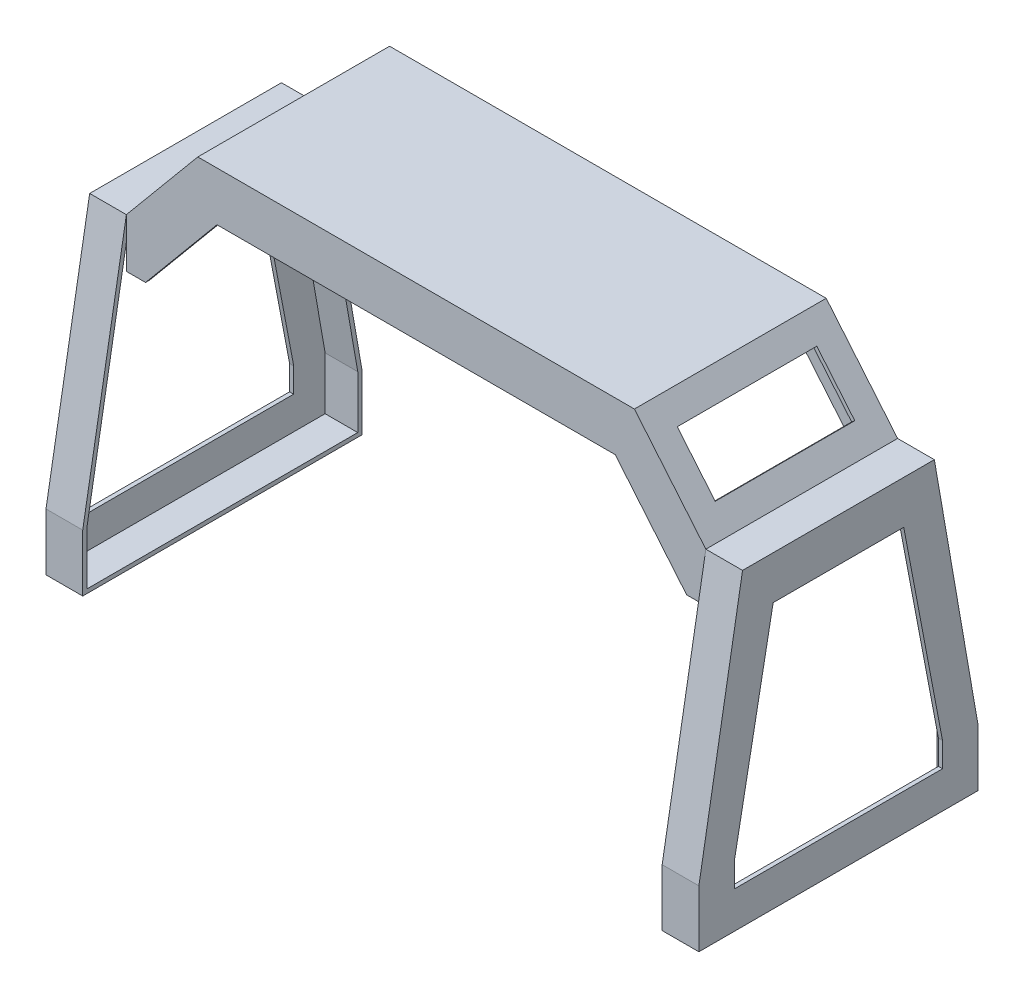
from build123d import *

# Parameters (mm, degrees)
CROQUIS1_W              = 800
CROQUIS1_H              = 342
SALIENTE_EXTRUIR1_DEPTH = 483
CROQUIS2_W              = 710
CROQUIS2_H              = 53.5
CORTAR_EXTRUIR1_DEPTH   = 483
CORTAR_EXTRUIR2_DEPTH   = 342
CORTAR_EXTRUIR4_DEPTH   = 800
VACIADO2_START          = -265.15812527
VACIADO2_OUTLINE_W      = 105
VACIADO2_OUTLINE_H      = 225
VACIADO2_DEPTH          = 530.31625054
VACIADO2_START_2        = -395
VACIADO2_2_DEPTH        = 790
VACIADO2_3_DEPTH        = 40
VACIADO2_START_3        = 355
VACIADO2_4_DEPTH        = 40
VACIADO2_START_4        = -112.5
VACIADO2_5_DEPTH        = 225
CROQUIS8_W              = 171
CROQUIS8_H              = 72.679369328
CORTAR_EXTRUIR7_DEPTH   = 113
CROQUIS9_W              = 171
CROQUIS9_H              = 72.679369328
CORTAR_EXTRUIR8_DEPTH   = 113


with BuildPart() as part:
    # Croquis1 → Saliente-Extruir1 (new body)
    with BuildSketch(Plane(origin=(0, 0, 0), x_dir=(1, 0, 0), z_dir=(0, 1, 0))):
        Rectangle(CROQUIS1_W, CROQUIS1_H)
    extrude(amount=SALIENTE_EXTRUIR1_DEPTH)

    # Croquis2 → Cortar-Extruir1 (cut)
    with BuildSketch(Plane(origin=(0, 483, 0), x_dir=(1, 0, 0), z_dir=(0, 1, 0))):
        with Locations((0, 144.25)):
            Rectangle(CROQUIS2_W, CROQUIS2_H)
        with Locations((0, -144.25)):
            Rectangle(CROQUIS2_W, CROQUIS2_H)
    extrude(amount=-CORTAR_EXTRUIR1_DEPTH, mode=Mode.SUBTRACT)

    # Croquis3 → Cortar-Extruir2 (cut)
    with BuildSketch(Plane.XY.offset(171)):
        Polygon((-355, 317.779645743), (-355, 0), (355, 0), (355, 317.779645743), (331.5, 317.779645743), (244, 422.779645743), (-244, 422.779645743), (-331.5, 317.779645743), align=None)
        Polygon((267.5, 483), (355, 378), (400, 378), (400, 483), align=None)
        Polygon((-400, 483), (-400, 378), (-355, 378), (-267.5, 483), align=None)
    extrude(amount=-CORTAR_EXTRUIR2_DEPTH, mode=Mode.SUBTRACT)

    # Croquis4 → Cortar-Extruir4 (cut)
    with BuildSketch(Plane(origin=(400, 0, 0), x_dir=(0, 0, -1), z_dir=(1, 0, 0))):
        Polygon((171, 378), (171, 70), (117.5, 378), align=None)
        Polygon((-171, 70), (-117.5, 378), (-171, 378), align=None)
        Polygon((-127.5, 45), (127.5, 45), (127.5, 75), (80, 325), (-80, 325), (-127.5, 75), align=None)
    extrude(amount=-CORTAR_EXTRUIR4_DEPTH, mode=Mode.SUBTRACT)

    # Vaciado2: read off the stored shape, not the designer's step
    # Vaciado2 outline → Vaciado2 (cut)
    with BuildSketch(Plane.YZ.offset(VACIADO2_START)):
        with Locations((425.5, 0)):
            Rectangle(VACIADO2_OUTLINE_W, VACIADO2_OUTLINE_H)
    extrude(amount=VACIADO2_DEPTH, mode=Mode.SUBTRACT)

    # Vaciado2 2 outline → Vaciado2 2 (cut)
    with BuildSketch(Plane.YZ.offset(VACIADO2_START_2)):
        Polygon((373, -112.5), (373, 112.5), (317.779645743, 112.5), (317.779645743, 81.371867309), (325, 80), (325, -80), (317.779645743, -81.371867309), (317.779645743, -112.5), align=None)
    extrude(amount=VACIADO2_2_DEPTH, mode=Mode.SUBTRACT)

    # Vaciado2 3 outline → Vaciado2 3 (cut)
    with BuildSketch(Plane.YZ.offset(VACIADO2_START_2)):
        Polygon((69.568973838, 166), (5, 166), (5, -166), (69.568973838, -166), (373, -113.293636689), (373, -112.5), (317.779645743, -112.5), (317.779645743, -81.371867309), (75, -127.5), (45, -127.5), (45, 127.5), (75, 127.5), (317.779645743, 81.371867309), (317.779645743, 112.5), (373, 112.5), (373, 113.293636689), align=None)
    extrude(amount=VACIADO2_3_DEPTH, mode=Mode.SUBTRACT)

    # Vaciado2 4 outline → Vaciado2 4 (cut)
    with BuildSketch(Plane.YZ.offset(VACIADO2_START_3)):
        Polygon((69.568973838, 166), (5, 166), (5, -166), (69.568973838, -166), (373, -113.293636689), (373, -112.5), (317.779645743, -112.5), (317.779645743, -81.371867309), (75, -127.5), (45, -127.5), (45, 127.5), (75, 127.5), (317.779645743, 81.371867309), (317.779645743, 112.5), (373, 112.5), (373, 113.293636689), align=None)
    extrude(amount=VACIADO2_4_DEPTH, mode=Mode.SUBTRACT)

    # Vaciado2 5 outline → Vaciado2 5 (cut)
    with BuildSketch(Plane.XY.offset(VACIADO2_START_4)):
        Polygon((352.65812527, 373), (265.15812527, 478), (265.15812527, 397.389895419), (285.483038119, 373), align=None)
        Polygon((-265.15812527, 478), (-352.65812527, 373), (-285.483038119, 373), (-265.15812527, 397.389895419), align=None)
    extrude(amount=VACIADO2_5_DEPTH, mode=Mode.SUBTRACT)

    # Croquis8 → Cortar-Extruir7 (cut)
    with BuildSketch(Plane(origin=(395.409836066, 329.508196721, 0), x_dir=(0, 0, -1), z_dir=(0.7682212795973777, 0.6401843996644778, 0))):
        with Locations((0, 131.461866471)):
            Rectangle(CROQUIS8_W, CROQUIS8_H)
    extrude(amount=-CORTAR_EXTRUIR7_DEPTH, mode=Mode.SUBTRACT)

    # Croquis9 → Cortar-Extruir8 (cut)
    with BuildSketch(Plane(origin=(-395.409836066, 329.508196721, 0), x_dir=(0, 0, 1), z_dir=(-0.7682212795973777, 0.6401843996644778, 0))):
        with Locations((0, 131.461866471)):
            Rectangle(CROQUIS9_W, CROQUIS9_H)
    extrude(amount=-CORTAR_EXTRUIR8_DEPTH, mode=Mode.SUBTRACT)


solid = part.part
